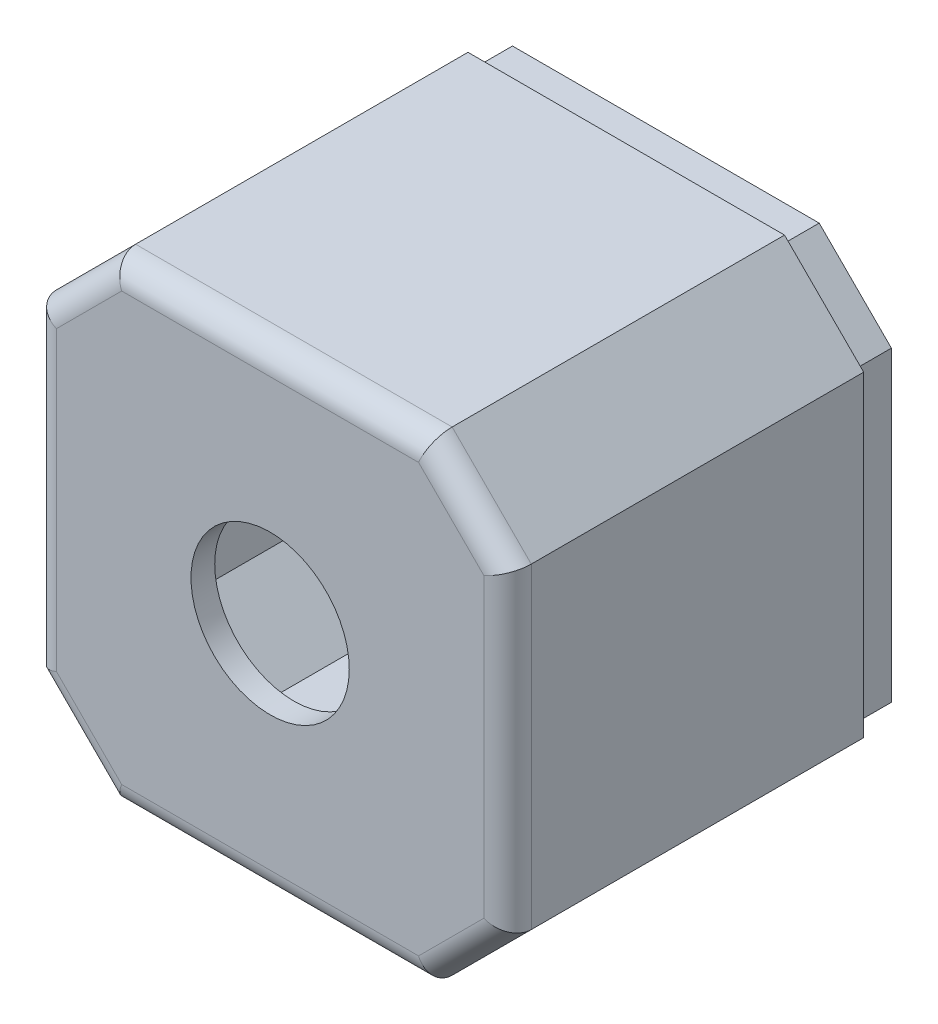
from build123d import *

# Parameters (mm, degrees)
SKETCH1_W           = 60
SKETCH1_H           = 60
BOSS_EXTRUDE1_DEPTH = 50
CHAMFER1_SIZE       = 10
FILLET1_R           = 3
SHELL2_DEPTH        = 47
CUT_EXTRUDE1_REACH  = 100.489
SKETCH2_R           = 10
CUT_EXTRUDE2_DEPTH  = 5


# Read off the part's stored shape, not the designer's step: Shell2
with BuildPart() as part:
    # Sketch1 → Boss-Extrude1 (new body)
    with BuildSketch(Plane.XY):
        with Locations((30, 30)):
            Rectangle(SKETCH1_W, SKETCH1_H)
    extrude(amount=BOSS_EXTRUDE1_DEPTH)

    # Chamfer1
    chamfer1_edges = [part.edges().sort_by_distance(p)[0] for p in [
        (0, 60, 25),
        (60, 60, 25),
        (60, 0, 25),
        (0, 0, 25),
    ]]
    chamfer(chamfer1_edges, length=CHAMFER1_SIZE)

    # Fillet1
    fillet1_edges = [part.edges().sort_by_distance(p)[0] for p in [
        (0, 30, 50),
        (30, 60, 50),
        (30, 0, 50),
        (60, 30, 50),
        (55, 55, 50),
        (55, 5, 50),
        (5, 5, 50),
        (5, 55, 50),
    ]]
    fillet(fillet1_edges, radius=FILLET1_R)

    # Shell2 outline → Shell2 (cut)
    with BuildSketch(Plane.XY):
        Polygon((3, 48.757359313), (3, 11.242640687), (11.242640687, 3), (48.757359313, 3), (57, 11.242640687), (57, 48.757359313), (48.757359313, 57), (11.242640687, 57), align=None)
    extrude(amount=SHELL2_DEPTH, mode=Mode.SUBTRACT)

    # Sketch2 → Cut-Extrude1 (cut, up to next)
    with BuildSketch(Plane.XY.offset(50), mode=Mode.PRIVATE) as cut_extrude1_sk1:
        with Locations((30, 30)):
            Circle(SKETCH2_R)
    cut_extrude1_tool1 = extrude(cut_extrude1_sk1.sketch, amount=-CUT_EXTRUDE1_REACH, mode=Mode.PRIVATE) & part.part
    add(cut_extrude1_tool1.solids().sort_by_distance((30, 30, 50))[0], mode=Mode.SUBTRACT)

    # Sketch3 → Cut-Extrude2 (cut)
    with BuildSketch(Plane(origin=(0, 0, 0), x_dir=(-1, 0, 0), z_dir=(0, 0, -1))):
        Polygon((0, 10), (0, 50), (-10, 60), (-50, 60), (-60, 50), (-60, 10), (-50, 0), (-10, 0), align=None)
        Polygon((-1.5, 10.621320344), (-1.5, 49.378679656), (-10.621320344, 58.5), (-49.378679656, 58.5), (-58.5, 49.378679656), (-58.5, 10.621320344), (-49.378679656, 1.5), (-10.621320344, 1.5), align=None, mode=Mode.SUBTRACT)
    extrude(amount=-CUT_EXTRUDE2_DEPTH, mode=Mode.SUBTRACT)


solid = part.part
